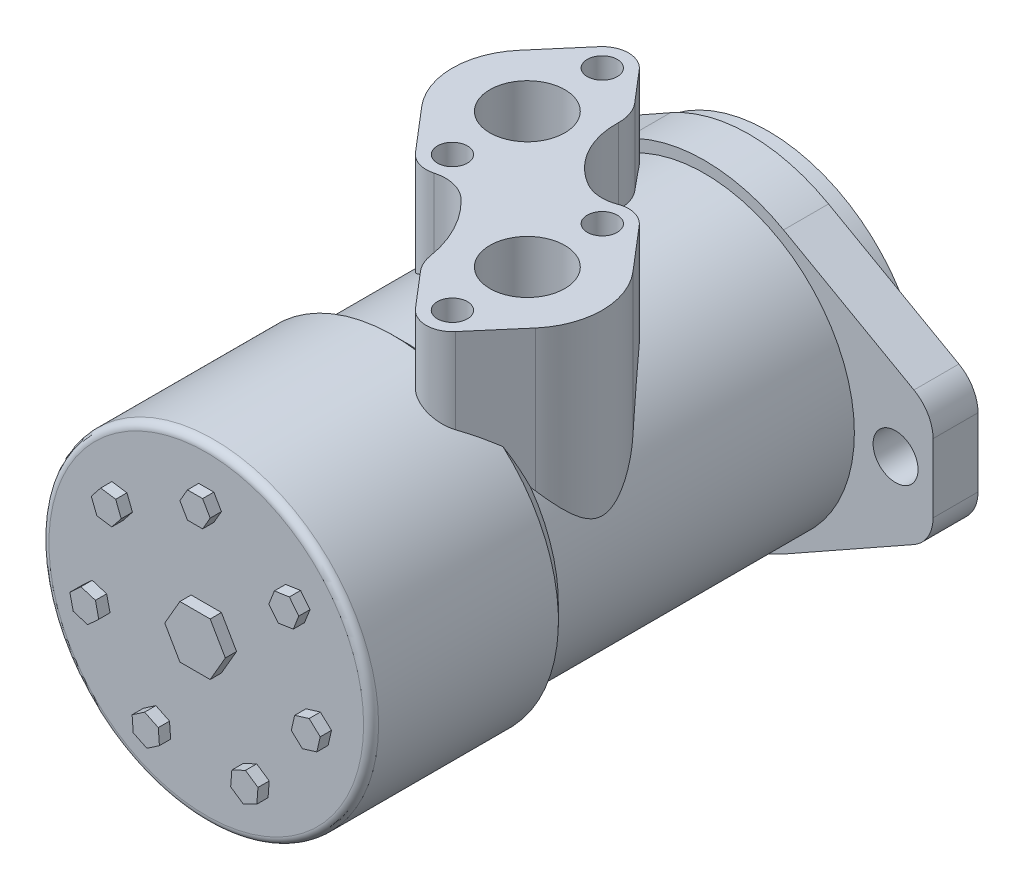
from build123d import *

# Parameters (mm, degrees)
SKETCH_1_R            = 41.275
EXTRUDE_1_DEPTH       = 5
SKETCH_2_R            = 6
EXTRUDE_2_DEPTH       = 12
SKETCH_3_R            = 40
EXTRUDE_3_DEPTH       = 79
SKETCH_4_R            = 44
EXTRUDE_4_DEPTH       = 54
CHAMFER_1_SIZE        = 4
EXTRUDE_START         = -27.509996997
EXTRUDE_6_OUTLINE_R   = 4
EXTRUDE_6_OUTLINE_R_2 = 10
EXTRUDE_6_DEPTH       = 47.509996997
FILLET_2_R            = 2
EXTRUDE_8_DEPTH       = 3


with BuildPart() as part:
    # 草图1 → 凸台-拉伸1 (new body)
    with BuildSketch(Plane.XY):
        Circle(SKETCH_1_R)
    extrude(amount=EXTRUDE_1_DEPTH)

    # 草图2 → 凸台-拉伸2 (add)
    with BuildSketch(Plane.XY.offset(5)):
        with BuildLine():
            Line((55.906499776, 17.868085601), (21.097949035, 37.468340589))
            ThreePointArc((21.097949035, 37.468340589), (0, 43), (-21.097949035, 37.468340589))
            Line((-21.097949035, 37.468340589), (-55.906499776, 17.868085601))
            ThreePointArc((-55.906499776, 17.868085601), (-59.633220655, 14.201051597), (-61, 9.154518022))
            Line((-61, 9.154518022), (-61, -9.154518022))
            ThreePointArc((-61, -9.154518022), (-59.633220655, -14.201051597), (-55.906499776, -17.868085601))
            Line((-55.906499776, -17.868085601), (-21.097949035, -37.468340589))
            ThreePointArc((-21.097949035, -37.468340589), (0, -43), (21.097949035, -37.468340589))
            Line((21.097949035, -37.468340589), (55.906499776, -17.868085601))
            ThreePointArc((55.906499776, -17.868085601), (59.633220655, -14.201051597), (61, -9.154518022))
            Line((61, -9.154518022), (61, 9.154518022))
            ThreePointArc((61, 9.154518022), (59.633220655, 14.201051597), (55.906499776, 17.868085601))
        make_face()
        with Locations((51, 0)):
            Circle(SKETCH_2_R, mode=Mode.SUBTRACT)
        with Locations(Location((-51, 0, 0), (0, 0, 180))):
            Circle(SKETCH_2_R, mode=Mode.SUBTRACT)
    extrude(amount=EXTRUDE_2_DEPTH)

    # 草图3 → 凸台-拉伸3 (add)
    with BuildSketch(Plane.XY.offset(17)):
        Circle(SKETCH_3_R)
    extrude(amount=EXTRUDE_3_DEPTH)

    # 草图4 → 凸台-拉伸4 (add)
    with BuildSketch(Plane.XY.offset(96)):
        Circle(SKETCH_4_R)
    extrude(amount=EXTRUDE_4_DEPTH)

    # 倒角1
    chamfer_1_edges = [part.edges().sort_by_distance(p)[0] for p in [
        (-44, 0, 96),
    ]]
    chamfer(chamfer_1_edges, length=CHAMFER_1_SIZE - 0.0001)  # a hair under: the kernel refuses the full size


with BuildPart() as extrude_6_tool:
    # 凸台-拉伸6: read off the stored shape, not the designer's step
    # 凸台-拉伸6 outline → 凸台-拉伸6 (new body)
    with BuildSketch(Plane(origin=(0, 40, 0), x_dir=(-1, 0, 0), z_dir=(0, 1, 0)).offset(EXTRUDE_START)):
        with BuildLine():
            Line((-4.766828737, 97.594632902), (-12.680460517, 106.846693665))
            ThreePointArc((-12.680460517, 106.846693665), (-17.999999981, 109.296693699), (-23.319539458, 106.846693694))
            Line((-23.319539458, 106.846693694), (-33.198684154, 95.296693699))
            ThreePointArc((-33.198684154, 95.296693699), (-38, 82.296693699), (-33.198684154, 69.296693699))
            Line((-33.198684154, 69.296693699), (-23.319539454, 57.746693699))
            ThreePointArc((-23.319539454, 57.746693699), (-19.736115425, 55.515403024), (-15.521326951, 55.750230538))
            ThreePointArc((-15.521326951, 55.750230538), (-11.181774437, 56.366201925), (-6.995640335, 55.067195361))
            ThreePointArc((-6.995640335, 55.067195361), (0.630563551, 47.348466647), (3.211752057, 36.809243499))
            ThreePointArc((3.211752057, 36.809243499), (3.776846647, 33.188937179), (5.608086416, 30.015215285))
            Line((5.608086416, 30.015215285), (12.680460546, 21.746693699))
            ThreePointArc((12.680460546, 21.746693699), (18, 19.296693699), (23.319539454, 21.746693699))
            Line((23.319539454, 21.746693699), (33.198684154, 33.296693699))
            ThreePointArc((33.198684154, 33.296693699), (38, 46.296693699), (33.198684154, 59.296693699))
            Line((33.198684154, 59.296693699), (23.319539454, 70.846693699))
            ThreePointArc((23.319539454, 70.846693699), (20.040045243, 72.992828062), (16.121018706, 73.039796049))
            ThreePointArc((16.121018706, 73.039796049), (10.977098455, 72.980015157), (6.484090398, 75.485283187))
            ThreePointArc((6.484090398, 75.485283187), (0.602615503, 83.359901998), (-2.493920761, 92.687968867))
            ThreePointArc((-2.493920761, 92.687968867), (-3.292418967, 95.297851728), (-4.766828737, 97.594632902))
        make_face()
        with Locations((-18, 62.296693699)):
            Circle(EXTRUDE_6_OUTLINE_R, mode=Mode.SUBTRACT)
        with Locations((18, 26.296693699)):
            Circle(EXTRUDE_6_OUTLINE_R, mode=Mode.SUBTRACT)
        with Locations((18, 46.296693699)):
            Circle(EXTRUDE_6_OUTLINE_R_2, mode=Mode.SUBTRACT)
        with Locations((-18, 82.296693699)):
            Circle(EXTRUDE_6_OUTLINE_R_2, mode=Mode.SUBTRACT)
        with Locations((-18, 102.296693699)):
            Circle(EXTRUDE_6_OUTLINE_R, mode=Mode.SUBTRACT)
        with Locations((18, 66.296693699)):
            Circle(EXTRUDE_6_OUTLINE_R, mode=Mode.SUBTRACT)
    extrude(amount=EXTRUDE_6_DEPTH)


with BuildPart() as part_1:
    add(part.part)


with BuildPart() as part_2:
    # 凸台-拉伸6: joined with extrude_6_tool
    add(part_1.part.fuse(extrude_6_tool.part, tol=0.00001))

    # 圆角2
    fillet_2_edges = [part_2.edges().sort_by_distance(p)[0] for p in [
        (-44, 0, 150),
    ]]
    fillet(fillet_2_edges, radius=FILLET_2_R)

    # 草图11 → 凸台-拉伸8 (add)
    with BuildSketch(Plane.XY.offset(150)):
        Polygon((-2.020725942, 26.815974739), (2.020725942, 26.815974739), (4.041451884, 30.315974739), (2.020725942, 33.815974739), (-2.020725942, 33.815974739), (-4.041451884, 30.315974739), align=None)
        Polygon((19.705671267, 18.299353936), (22.225475301, 15.139619618), (26.221787507, 15.741966765), (27.698295678, 19.504048231), (25.178491644, 22.663782549), (21.182179438, 22.061435401), align=None)
        Polygon((26.593296089, -3.99705362), (25.693988441, -7.937177868), (28.65658231, -10.68606326), (32.518483827, -9.494824405), (33.417791474, -5.554700158), (30.455197606, -2.805814765), align=None)
        Polygon((13.455626552, -23.283598275), (9.814404223, -25.03711853), (9.512386146, -29.067269695), (12.851590397, -31.343900605), (16.492812726, -29.59038035), (16.794830804, -25.560229185), align=None)
        Polygon((-9.814404223, -25.03711853), (-13.455626552, -23.283598275), (-16.794830804, -25.560229185), (-16.492812726, -29.59038035), (-12.851590397, -31.343900605), (-9.512386146, -29.067269695), align=None)
        Polygon((-25.693988441, -7.937177868), (-26.593296089, -3.99705362), (-30.455197606, -2.805814765), (-33.417791474, -5.554700158), (-32.518483827, -9.494824405), (-28.65658231, -10.68606326), align=None)
        Polygon((-22.225475301, 15.139619618), (-19.705671267, 18.299353936), (-21.182179438, 22.061435401), (-25.178491644, 22.663782549), (-27.698295678, 19.504048231), (-26.221787507, 15.741966765), align=None)
        Polygon((-4.041451884, -7), (4.041451884, -7), (8.082903769, 0), (4.041451884, 7), (-4.041451884, 7), (-8.082903769, 0), align=None)
    extrude(amount=EXTRUDE_8_DEPTH)


solid = part_2.part
